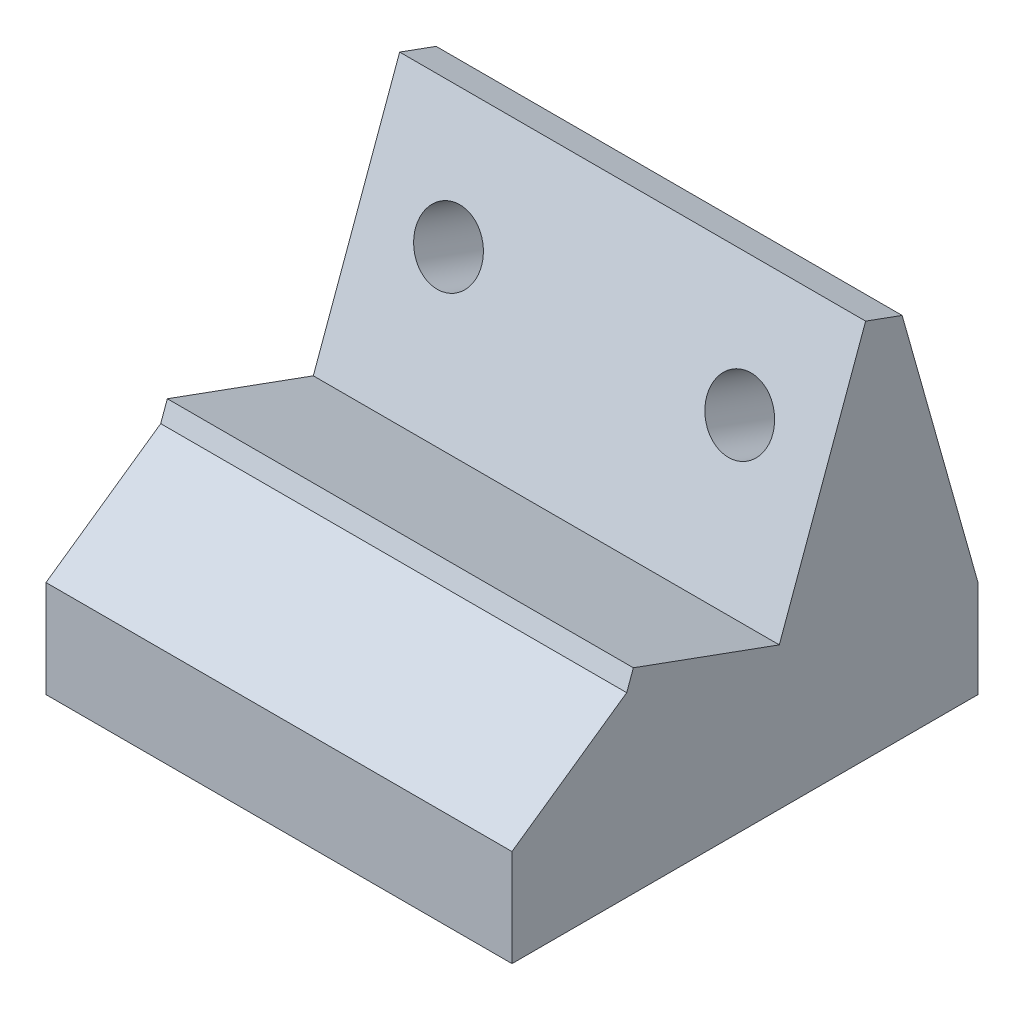
from build123d import *

# Parameters (mm, degrees)
SKETCH1_W                = 30.48
SKETCH1_H                = 16.51
BOSS_EXTRUDE1_DEPTH      = 2.54
BOSS_EXTRUDE2_DEPTH      = 10.16
BOSS_EXTRUDE2_DEPTH_BACK = 2.54
SKETCH3_W                = 30.48
SKETCH3_H                = 1.27
SKETCH4_W                = 30.48
SKETCH4_H                = 30.48
BOSS_EXTRUDE3_DEPTH      = 2.54
BODY_MOVE_COPY3_ANGLE    = 70
LOFT2_START              = -14.571578947
LOFT2_DEPTH              = 30.48
SKETCH5_R                = 2.159
CUT_EXTRUDE1_DEPTH       = 31.007586006
SKETCH6_W                = 30.48
SKETCH6_H                = 30.48
BOSS_EXTRUDE4_DEPTH      = 3.81


# Read off the part's stored shape, not the designer's step: Loft2
with BuildPart() as part:
    # Sketch1 → Boss-Extrude1 (new body)
    with BuildSketch(Plane(origin=(0, 0, 0), x_dir=(1, 0, 0), z_dir=(0, 1, 0))):
        with Locations((0.668421053, -1.938421053)):
            Rectangle(SKETCH1_W, SKETCH1_H)
    extrude(amount=BOSS_EXTRUDE1_DEPTH)

    # Sketch3 → Boss-Extrude2 (add, two sides: drawn at the far end of the back side and taken through both)
    with BuildSketch(Plane(origin=(0, 2.54, 0), x_dir=(1, 0, 0), z_dir=(0, 1, 0)).offset(-BOSS_EXTRUDE2_DEPTH_BACK)):
        with Locations((0.668421053, -10.828421053)):
            Rectangle(SKETCH3_W, SKETCH3_H)
    extrude(amount=BOSS_EXTRUDE2_DEPTH + BOSS_EXTRUDE2_DEPTH_BACK)


with BuildPart() as part_1:
    # Body-Move/Copy1: moved
    add(part.part.moved(Location((0, 7.62, 0))))


with BuildPart() as body_2:
    # Sketch4 → Boss-Extrude3 (new body)
    with BuildSketch(Plane(origin=(0, 0, 0), x_dir=(1, 0, 0), z_dir=(0, 1, 0))):
        with Locations((0.668421053, -3.843421053)):
            Rectangle(SKETCH4_W, SKETCH4_H)
    extrude(amount=BOSS_EXTRUDE3_DEPTH)


with BuildPart() as part_2:
    # Body-Move/Copy3: moved
    add(part_1.part.rotate(Axis((0, 13.97, 2.573421053), (1, 0, 0)), BODY_MOVE_COPY3_ANGLE))


    add(body_2.part)  # loft1 joins it to this body
    # loft from a face of the part (loft1)
    loft([part_2.faces().sort_by_distance((0.668421053, 5.616132601, 5.613980127))[0], part_2.faces().sort_by_distance((0.668421053, 2.54, 3.843421053))[0]])

    # Loft2 outline → Loft2 (add)
    with BuildSketch(Plane.YZ.offset(LOFT2_START)):
        Polygon((3.444304691, -0.353068015), (2.54, -11.396578947), (20.152039489, -6.434186164), align=None)
    extrude(amount=LOFT2_DEPTH)

    # Sketch5 → Cut-Extrude1 (cut, through all)
    with BuildSketch(Plane(origin=(0, 1.158164402, 3.182030543), x_dir=(1, 0, 0), z_dir=(0, 0.3420201433256677, 0.9396926207859089))):
        with Locations(Location((-8.856578947, 13.771344075, 0), (0, 0, 270))):
            Circle(SKETCH5_R)
        with Locations(Location((10.193421053, 13.771344075, 0), (0, 0, 270))):
            Circle(SKETCH5_R)
    extrude(amount=-CUT_EXTRUDE1_DEPTH, mode=Mode.SUBTRACT)

    # Sketch6 → Boss-Extrude4 (add)
    with BuildSketch(Plane.XZ):
        with Locations((0.668421053, 3.843421053)):
            Rectangle(SKETCH6_W, SKETCH6_H)
    extrude(amount=BOSS_EXTRUDE4_DEPTH)


solid = part_2.part
